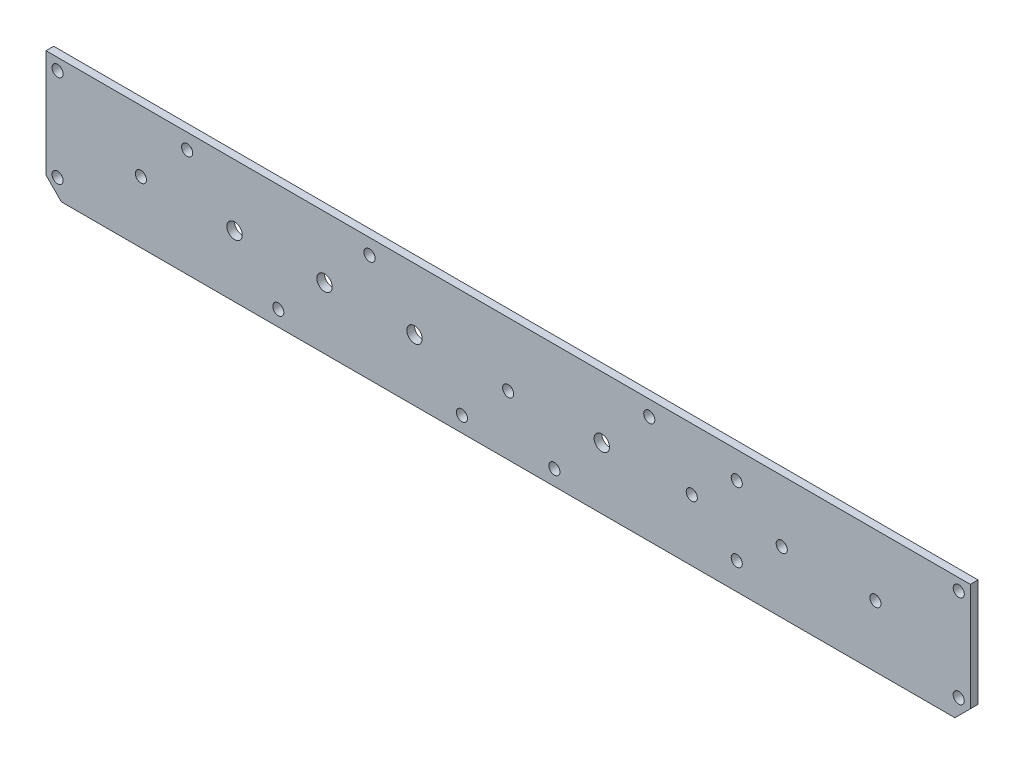
from build123d import *

# Parameters (mm, degrees)
SKETCH1_W           = 381
SKETCH1_H           = 50.8
BOSS_EXTRUDE1_DEPTH = 3.175
CUT_EXTRUDE1_REACH  = 386.385
SKETCH2_R           = 2.286
SKETCH2_R_2         = 3.175


with BuildPart() as part:
    # Sketch1 → Boss-Extrude1 (new body)
    with BuildSketch(Plane.XY):
        with Locations((190.5, 25.4)):
            Rectangle(SKETCH1_W, SKETCH1_H)
    extrude(amount=BOSS_EXTRUDE1_DEPTH)

    # Sketch2 → Cut-Extrude1 (cut, up to next)
    with BuildSketch(Plane.XY.offset(3.175), mode=Mode.PRIVATE) as cut_extrude1_sk1:
        with Locations((39.116, 25.4)):
            Circle(SKETCH2_R)
    cut_extrude1_tool1 = extrude(cut_extrude1_sk1.sketch, amount=-CUT_EXTRUDE1_REACH, mode=Mode.PRIVATE) & part.part
    # Sketch2 → Cut-Extrude1 (cut, up to next)
    with BuildSketch(Plane.XY.offset(3.175), mode=Mode.PRIVATE) as cut_extrude1_sk2:
        with Locations((190.5, 24.60625)):
            Circle(SKETCH2_R)
    cut_extrude1_tool2 = extrude(cut_extrude1_sk2.sketch, amount=-CUT_EXTRUDE1_REACH, mode=Mode.PRIVATE) & part.part
    # Sketch2 → Cut-Extrude1 (cut, up to next)
    with BuildSketch(Plane.XY.offset(3.175), mode=Mode.PRIVATE) as cut_extrude1_sk3:
        with Locations((114.808, 25.4)):
            Circle(SKETCH2_R_2)
    cut_extrude1_tool3 = extrude(cut_extrude1_sk3.sketch, amount=-CUT_EXTRUDE1_REACH, mode=Mode.PRIVATE) & part.part
    # Sketch2 → Cut-Extrude1 (cut, up to next)
    with BuildSketch(Plane.XY.offset(3.175), mode=Mode.PRIVATE) as cut_extrude1_sk4:
        with Locations((77.724, 25.4)):
            Circle(SKETCH2_R_2)
    cut_extrude1_tool4 = extrude(cut_extrude1_sk4.sketch, amount=-CUT_EXTRUDE1_REACH, mode=Mode.PRIVATE) & part.part
    # Sketch2 → Cut-Extrude1 (cut, up to next)
    with BuildSketch(Plane.XY.offset(3.175), mode=Mode.PRIVATE) as cut_extrude1_sk5:
        with Locations((151.892, 25.4)):
            Circle(SKETCH2_R_2)
    cut_extrude1_tool5 = extrude(cut_extrude1_sk5.sketch, amount=-CUT_EXTRUDE1_REACH, mode=Mode.PRIVATE) & part.part
    # Sketch2 → Cut-Extrude1 (cut, up to next)
    with BuildSketch(Plane.XY.offset(3.175), mode=Mode.PRIVATE) as cut_extrude1_sk6:
        with Locations((229.108, 25.4)):
            Circle(SKETCH2_R_2)
    cut_extrude1_tool6 = extrude(cut_extrude1_sk6.sketch, amount=-CUT_EXTRUDE1_REACH, mode=Mode.PRIVATE) & part.part
    # Sketch2 → Cut-Extrude1 (cut, up to next)
    with BuildSketch(Plane.XY.offset(3.175), mode=Mode.PRIVATE) as cut_extrude1_sk7:
        with Locations((303.276, 25.4)):
            Circle(SKETCH2_R)
    cut_extrude1_tool7 = extrude(cut_extrude1_sk7.sketch, amount=-CUT_EXTRUDE1_REACH, mode=Mode.PRIVATE) & part.part
    # Sketch2 → Cut-Extrude1 (cut, up to next)
    with BuildSketch(Plane.XY.offset(3.175), mode=Mode.PRIVATE) as cut_extrude1_sk8:
        with Locations((266.192, 25.4)):
            Circle(SKETCH2_R)
    cut_extrude1_tool8 = extrude(cut_extrude1_sk8.sketch, amount=-CUT_EXTRUDE1_REACH, mode=Mode.PRIVATE) & part.part
    # Sketch2 → Cut-Extrude1 (cut, up to next)
    with BuildSketch(Plane.XY.offset(3.175), mode=Mode.PRIVATE) as cut_extrude1_sk9:
        with Locations((341.884, 25.4)):
            Circle(SKETCH2_R)
    cut_extrude1_tool9 = extrude(cut_extrude1_sk9.sketch, amount=-CUT_EXTRUDE1_REACH, mode=Mode.PRIVATE) & part.part
    # Sketch2 → Cut-Extrude1 (cut, up to next)
    with BuildSketch(Plane.XY.offset(3.175), mode=Mode.PRIVATE) as cut_extrude1_sk10:
        with Locations((58.166, 44.45)):
            Circle(SKETCH2_R)
    cut_extrude1_tool10 = extrude(cut_extrude1_sk10.sketch, amount=-CUT_EXTRUDE1_REACH, mode=Mode.PRIVATE) & part.part
    # Sketch2 → Cut-Extrude1 (cut, up to next)
    with BuildSketch(Plane.XY.offset(3.175), mode=Mode.PRIVATE) as cut_extrude1_sk11:
        with Locations((171.45, 6.35)):
            Circle(SKETCH2_R)
    cut_extrude1_tool11 = extrude(cut_extrude1_sk11.sketch, amount=-CUT_EXTRUDE1_REACH, mode=Mode.PRIVATE) & part.part
    # Sketch2 → Cut-Extrude1 (cut, up to next)
    with BuildSketch(Plane.XY.offset(3.175), mode=Mode.PRIVATE) as cut_extrude1_sk12:
        with Locations((209.55, 6.35)):
            Circle(SKETCH2_R)
    cut_extrude1_tool12 = extrude(cut_extrude1_sk12.sketch, amount=-CUT_EXTRUDE1_REACH, mode=Mode.PRIVATE) & part.part
    # Sketch2 → Cut-Extrude1 (cut, up to next)
    with BuildSketch(Plane.XY.offset(3.175), mode=Mode.PRIVATE) as cut_extrude1_sk13:
        with Locations((133.35, 44.45)):
            Circle(SKETCH2_R)
    cut_extrude1_tool13 = extrude(cut_extrude1_sk13.sketch, amount=-CUT_EXTRUDE1_REACH, mode=Mode.PRIVATE) & part.part
    # Sketch2 → Cut-Extrude1 (cut, up to next)
    with BuildSketch(Plane.XY.offset(3.175), mode=Mode.PRIVATE) as cut_extrude1_sk14:
        with Locations((248.666, 44.45)):
            Circle(SKETCH2_R)
    cut_extrude1_tool14 = extrude(cut_extrude1_sk14.sketch, amount=-CUT_EXTRUDE1_REACH, mode=Mode.PRIVATE) & part.part
    # Sketch2 → Cut-Extrude1 (cut, up to next)
    with BuildSketch(Plane.XY.offset(3.175), mode=Mode.PRIVATE) as cut_extrude1_sk15:
        with Locations((95.758, 6.35)):
            Circle(SKETCH2_R)
    cut_extrude1_tool15 = extrude(cut_extrude1_sk15.sketch, amount=-CUT_EXTRUDE1_REACH, mode=Mode.PRIVATE) & part.part
    # Sketch2 → Cut-Extrude1 (cut, up to next)
    with BuildSketch(Plane.XY.offset(3.175), mode=Mode.PRIVATE) as cut_extrude1_sk16:
        with Locations((4.7625, 46.0375)):
            Circle(SKETCH2_R)
    cut_extrude1_tool16 = extrude(cut_extrude1_sk16.sketch, amount=-CUT_EXTRUDE1_REACH, mode=Mode.PRIVATE) & part.part
    # Sketch2 → Cut-Extrude1 (cut, up to next)
    with BuildSketch(Plane.XY.offset(3.175), mode=Mode.PRIVATE) as cut_extrude1_sk17:
        with Locations((4.7625, 7.9375)):
            Circle(SKETCH2_R)
    cut_extrude1_tool17 = extrude(cut_extrude1_sk17.sketch, amount=-CUT_EXTRUDE1_REACH, mode=Mode.PRIVATE) & part.part
    # Sketch2 → Cut-Extrude1 (cut, up to next)
    with BuildSketch(Plane.XY.offset(3.175), mode=Mode.PRIVATE) as cut_extrude1_sk18:
        with Locations((376.2375, 7.9375)):
            Circle(SKETCH2_R)
    cut_extrude1_tool18 = extrude(cut_extrude1_sk18.sketch, amount=-CUT_EXTRUDE1_REACH, mode=Mode.PRIVATE) & part.part
    # Sketch2 → Cut-Extrude1 (cut, up to next)
    with BuildSketch(Plane.XY.offset(3.175), mode=Mode.PRIVATE) as cut_extrude1_sk19:
        with Locations((376.2375, 46.0375)):
            Circle(SKETCH2_R)
    cut_extrude1_tool19 = extrude(cut_extrude1_sk19.sketch, amount=-CUT_EXTRUDE1_REACH, mode=Mode.PRIVATE) & part.part
    # Sketch2 → Cut-Extrude1 (cut, up to next)
    with BuildSketch(Plane.XY.offset(3.175), mode=Mode.PRIVATE) as cut_extrude1_sk20:
        with Locations((284.734, 11.1125)):
            Circle(SKETCH2_R)
    cut_extrude1_tool20 = extrude(cut_extrude1_sk20.sketch, amount=-CUT_EXTRUDE1_REACH, mode=Mode.PRIVATE) & part.part
    # Sketch2 → Cut-Extrude1 (cut, up to next)
    with BuildSketch(Plane.XY.offset(3.175), mode=Mode.PRIVATE) as cut_extrude1_sk21:
        with Locations((284.734, 39.6875)):
            Circle(SKETCH2_R)
    cut_extrude1_tool21 = extrude(cut_extrude1_sk21.sketch, amount=-CUT_EXTRUDE1_REACH, mode=Mode.PRIVATE) & part.part
    # Sketch2 → Cut-Extrude1 (cut, up to next)
    with BuildSketch(Plane.XY.offset(3.175), mode=Mode.PRIVATE) as cut_extrude1_sk22:
        Polygon((0, 6.35), (0, 0), (6.35, 0), align=None)
    cut_extrude1_tool22 = extrude(cut_extrude1_sk22.sketch, amount=-CUT_EXTRUDE1_REACH, mode=Mode.PRIVATE) & part.part
    # Sketch2 → Cut-Extrude1 (cut, up to next)
    with BuildSketch(Plane.XY.offset(3.175), mode=Mode.PRIVATE) as cut_extrude1_sk23:
        Polygon((381, 0), (374.65, 0), (381, 6.35), align=None)
    cut_extrude1_tool23 = extrude(cut_extrude1_sk23.sketch, amount=-CUT_EXTRUDE1_REACH, mode=Mode.PRIVATE) & part.part
    add(cut_extrude1_tool1.solids().sort_by_distance((39.116, 25.4, 3.175))[0], mode=Mode.SUBTRACT)
    add(cut_extrude1_tool2.solids().sort_by_distance((190.5, 24.60625, 3.175))[0], mode=Mode.SUBTRACT)
    add(cut_extrude1_tool3.solids().sort_by_distance((114.808, 25.4, 3.175))[0], mode=Mode.SUBTRACT)
    add(cut_extrude1_tool4.solids().sort_by_distance((77.724, 25.4, 3.175))[0], mode=Mode.SUBTRACT)
    add(cut_extrude1_tool5.solids().sort_by_distance((151.892, 25.4, 3.175))[0], mode=Mode.SUBTRACT)
    add(cut_extrude1_tool6.solids().sort_by_distance((229.108, 25.4, 3.175))[0], mode=Mode.SUBTRACT)
    add(cut_extrude1_tool7.solids().sort_by_distance((303.276, 25.4, 3.175))[0], mode=Mode.SUBTRACT)
    add(cut_extrude1_tool8.solids().sort_by_distance((266.192, 25.4, 3.175))[0], mode=Mode.SUBTRACT)
    add(cut_extrude1_tool9.solids().sort_by_distance((341.884, 25.4, 3.175))[0], mode=Mode.SUBTRACT)
    add(cut_extrude1_tool10.solids().sort_by_distance((58.166, 44.45, 3.175))[0], mode=Mode.SUBTRACT)
    add(cut_extrude1_tool11.solids().sort_by_distance((171.45, 6.35, 3.175))[0], mode=Mode.SUBTRACT)
    add(cut_extrude1_tool12.solids().sort_by_distance((209.55, 6.35, 3.175))[0], mode=Mode.SUBTRACT)
    add(cut_extrude1_tool13.solids().sort_by_distance((133.35, 44.45, 3.175))[0], mode=Mode.SUBTRACT)
    add(cut_extrude1_tool14.solids().sort_by_distance((248.666, 44.45, 3.175))[0], mode=Mode.SUBTRACT)
    add(cut_extrude1_tool15.solids().sort_by_distance((95.758, 6.35, 3.175))[0], mode=Mode.SUBTRACT)
    add(cut_extrude1_tool16.solids().sort_by_distance((4.7625, 46.0375, 3.175))[0], mode=Mode.SUBTRACT)
    add(cut_extrude1_tool17.solids().sort_by_distance((4.7625, 7.9375, 3.175))[0], mode=Mode.SUBTRACT)
    add(cut_extrude1_tool18.solids().sort_by_distance((376.2375, 7.9375, 3.175))[0], mode=Mode.SUBTRACT)
    add(cut_extrude1_tool19.solids().sort_by_distance((376.2375, 46.0375, 3.175))[0], mode=Mode.SUBTRACT)
    add(cut_extrude1_tool20.solids().sort_by_distance((284.734, 11.1125, 3.175))[0], mode=Mode.SUBTRACT)
    add(cut_extrude1_tool21.solids().sort_by_distance((284.734, 39.6875, 3.175))[0], mode=Mode.SUBTRACT)
    add(cut_extrude1_tool22.solids().sort_by_distance((2.116667, 2.116667, 3.175))[0], mode=Mode.SUBTRACT)
    add(cut_extrude1_tool23.solids().sort_by_distance((378.883333, 2.116667, 3.175))[0], mode=Mode.SUBTRACT)


solid = part.part
